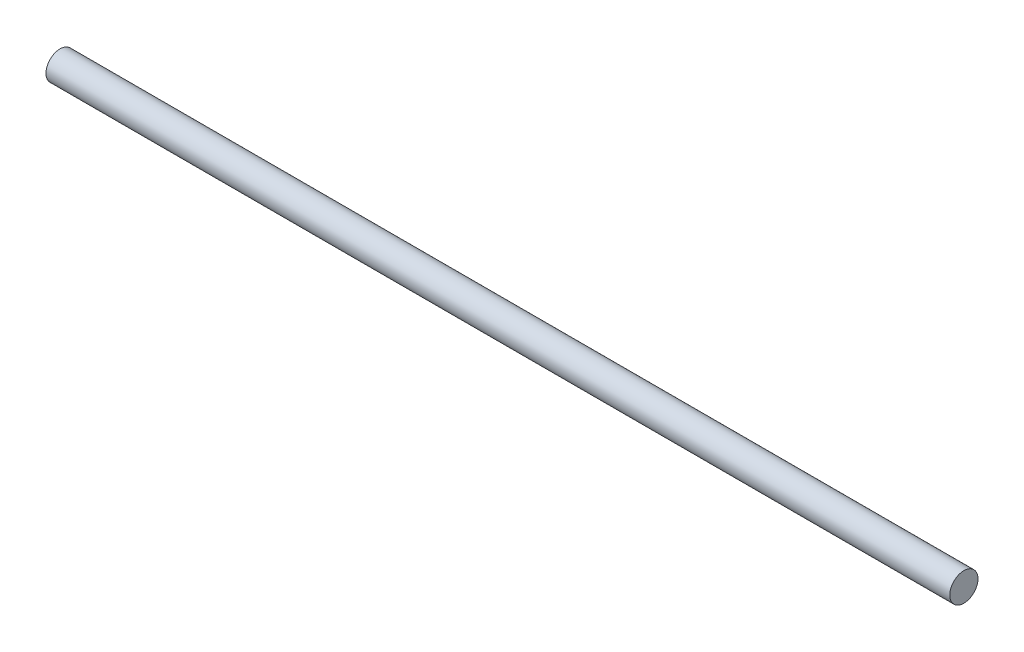
from build123d import *

# Parameters (mm, degrees)
BOSS_EXTRUDE1_DEPTH      = 50.8
BOSS_EXTRUDE1_DEPTH_BACK = 50.8
SKETCH1_R                = 1.5875


with BuildPart() as part:
    # Sketch1 → Boss-Extrude1 (new, two sides: drawn at the far end of the back side and taken through both)
    with BuildSketch(Plane(origin=(0, 0, 0), x_dir=(0, 0, -1), z_dir=(1, 0, 0)).offset(-BOSS_EXTRUDE1_DEPTH_BACK)):
        Circle(SKETCH1_R)
    extrude(amount=BOSS_EXTRUDE1_DEPTH + BOSS_EXTRUDE1_DEPTH_BACK)


solid = part.part
